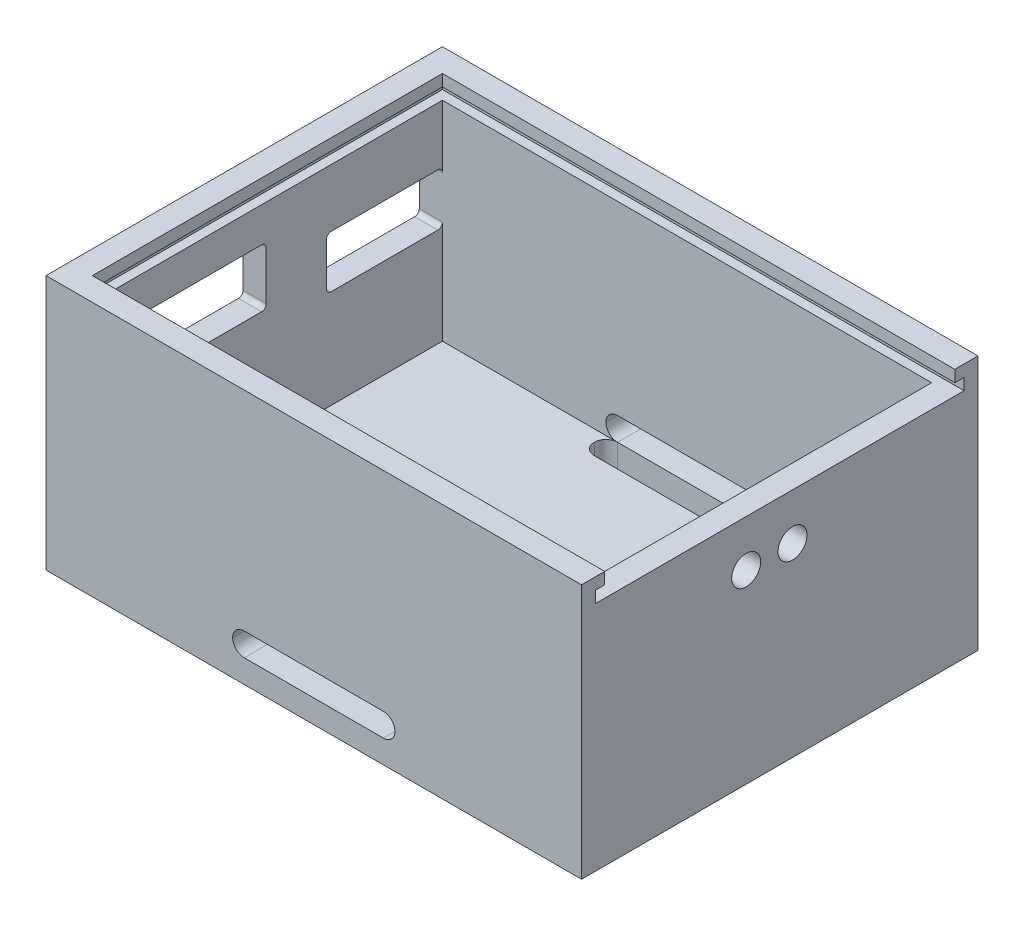
from build123d import *

# Parameters (mm, degrees)
SKETCH_1_W             = 46.2
SKETCH_1_H             = 34.2
EXTRUDE_1_DEPTH        = 22
SHELL_1_T              = -2
CUT_EXTRUDE_3_REACH    = 55.952
SKETCH_4_W             = 30.2
SKETCH_4_H             = 2
SKETCH_5_W             = 31.8
SKETCH_5_H             = 1
CUT_EXTRUDE_4_DEPTH    = 45
CUT_EXTRUDE_6_REACH    = 38.194
SKETCH_8_W             = 14
SKETCH_8_H             = 2
CUT_EXTRUDE_7_REACH    = 48.768
SKETCH_9_W             = 14
SKETCH_9_H             = 2
FILLET_3_R             = 1
FILLET_4_R             = 1
FILLET_3_OF_MIRROR_1_R = 1
FILLET_4_OF_MIRROR_1_R = 1
CUT_EXTRUDE_8_REACH    = 55.952
SKETCH_10_W            = 10
SKETCH_10_H            = 4.5
FILLET_6_R             = 0.4
CUT_EXTRUDE_9_REACH    = 55.952
SKETCH_11_W            = 11
SKETCH_11_H            = 5
FILLET_7_R             = 0.4
CUT_EXTRUDE_10_REACH   = 55.952
SKETCH_12_R            = 1.25


# Some blends are built 0.0001 mm under size
with BuildPart() as part:
    # 草图1 → 凸台-拉伸1 (new body)
    with BuildSketch(Plane(origin=(0, 0, 0), x_dir=(1, 0, 0), z_dir=(0, 1, 0))):
        Rectangle(SKETCH_1_W, SKETCH_1_H)
    extrude(amount=EXTRUDE_1_DEPTH)

    # 抽壳1
    shell_1_openings = [part.faces().sort_by_distance(p)[0] for p in [
        (0, 22, 0),
    ]]
    offset(amount=SHELL_1_T, openings=shell_1_openings, kind=Kind.INTERSECTION)

    # 草图4 → 切除-拉伸3 (cut, up to next)
    with BuildSketch(Plane(origin=(23.1, 0, 0), x_dir=(0, 0, -1), z_dir=(1, 0, 0)), mode=Mode.PRIVATE) as cut_extrude_3_sk1:
        with Locations((0, 21)):
            Rectangle(SKETCH_4_W, SKETCH_4_H)
    cut_extrude_3_tool1 = extrude(cut_extrude_3_sk1.sketch, amount=-CUT_EXTRUDE_3_REACH, mode=Mode.PRIVATE) & part.part
    add(cut_extrude_3_tool1.solids().sort_by_distance((23.1, 21, 0))[0], mode=Mode.SUBTRACT)

    # 草图5 → 切除-拉伸4 (cut)
    with BuildSketch(Plane(origin=(23.1, 0, 0), x_dir=(0, 0, -1), z_dir=(1, 0, 0))):
        with Locations((0, 20.5)):
            Rectangle(SKETCH_5_W, SKETCH_5_H)
    extrude(amount=-CUT_EXTRUDE_4_DEPTH, mode=Mode.SUBTRACT)

    # 草图8 → 切除-拉伸6 (cut, up to next)
    with BuildSketch(Plane.XZ, mode=Mode.PRIVATE) as cut_extrude_6_sk1:
        with Locations((0, -14.1)):
            Rectangle(SKETCH_8_W, SKETCH_8_H)
    cut_extrude_6_tool1 = extrude(cut_extrude_6_sk1.sketch, amount=-CUT_EXTRUDE_6_REACH, mode=Mode.PRIVATE) & part.part
    cut_extrude_6 = cut_extrude_6_tool1.solids().sort_by_distance((0, 0, -14.1))[0]
    add(cut_extrude_6, mode=Mode.SUBTRACT)

    # 草图9 → 切除-拉伸7 (cut, up to next)
    with BuildSketch(Plane(origin=(0, 0, -17.1), x_dir=(-1, 0, 0), z_dir=(0, 0, -1)), mode=Mode.PRIVATE) as cut_extrude_7_sk1:
        with Locations((0, 3)):
            Rectangle(SKETCH_9_W, SKETCH_9_H)
    cut_extrude_7_tool1 = extrude(cut_extrude_7_sk1.sketch, amount=-CUT_EXTRUDE_7_REACH, mode=Mode.PRIVATE) & part.part
    cut_extrude_7 = cut_extrude_7_tool1.solids().sort_by_distance((0, 3, -17.1))[0]
    add(cut_extrude_7, mode=Mode.SUBTRACT)

    # 圆角3
    # the kernel refuses this fillet: 1 mm, written as the material it adds along each edge
    with BuildSketch(Plane(origin=(-7, 4, -17.1), x_dir=(0, -1, 0), z_dir=(0, 0, 1)), Plane(origin=(-7, 2, -17.1), x_dir=(1, 0, 0), z_dir=(0, 0, 1)), Plane(origin=(7, 2, -17.1), x_dir=(0, 1, 0), z_dir=(0, 0, 1))) as fillet_3_piece_1:
        with BuildLine():
            CenterArc((FILLET_3_R, FILLET_3_R), FILLET_3_R, 180, 90)
            Line((0, FILLET_3_R), (0, 0))
            Line((0, 0), (FILLET_3_R, 0))
        make_face()
    extrude(amount=2)
    with BuildSketch(Plane(origin=(7, 4, -17.1), x_dir=(0, -1, 0), z_dir=(0, 0, 1))) as fillet_3_piece_2:
        with BuildLine():
            CenterArc((FILLET_3_R, -FILLET_3_R), FILLET_3_R, 90, 90)
            Line((0, -FILLET_3_R), (0, 0))
            Line((0, 0), (FILLET_3_R, 0))
        make_face()
    extrude(amount=2)

    # 圆角4
    fillet_4_edges = [part.edges().sort_by_distance(p)[0] for p in [
        (-7, 1, -15.1),
        (-7, 1, -13.1),
        (7, 1, -15.1),
        (7, 1, -13.1),
    ]]
    fillet(fillet_4_edges, radius=FILLET_4_R - 0.0001)  # a hair under: the kernel refuses the full size

    # 镜向1: 切除-拉伸6, 切除-拉伸7 across plane
    add(cut_extrude_6.mirror(Plane.XY), mode=Mode.SUBTRACT)
    add(cut_extrude_7.mirror(Plane.XY), mode=Mode.SUBTRACT)

    # 圆角3 of 镜向1
    # the kernel refuses this fillet: 1 mm, written as the material it adds along each edge
    with BuildSketch(Plane(origin=(-7, 4, 17.1), x_dir=(1, 0, 0), z_dir=(0, 0, -1)), Plane(origin=(-7, 2, 17.1), x_dir=(0, 1, 0), z_dir=(0, 0, -1)), Plane(origin=(7, 2, 17.1), x_dir=(-1, 0, 0), z_dir=(0, 0, -1))) as fillet_3_of_mirror_1_piece_1:
        with BuildLine():
            CenterArc((FILLET_3_OF_MIRROR_1_R, FILLET_3_OF_MIRROR_1_R), FILLET_3_OF_MIRROR_1_R, 180, 90)
            Line((0, FILLET_3_OF_MIRROR_1_R), (0, 0))
            Line((0, 0), (FILLET_3_OF_MIRROR_1_R, 0))
        make_face()
    extrude(amount=2)
    with BuildSketch(Plane(origin=(7, 4, 17.1), x_dir=(-1, 0, 0), z_dir=(0, 0, -1))) as fillet_3_of_mirror_1_piece_2:
        with BuildLine():
            CenterArc((FILLET_3_OF_MIRROR_1_R, -FILLET_3_OF_MIRROR_1_R), FILLET_3_OF_MIRROR_1_R, 90, 90)
            Line((0, -FILLET_3_OF_MIRROR_1_R), (0, 0))
            Line((0, 0), (FILLET_3_OF_MIRROR_1_R, 0))
        make_face()
    extrude(amount=2)

    # 圆角4 of 镜向1
    fillet_4_of_mirror_1_edges = [part.edges().sort_by_distance(p)[0] for p in [
        (-7, 1, 15.1),
        (-7, 1, 13.1),
        (7, 1, 15.1),
        (7, 1, 13.1),
    ]]
    fillet(fillet_4_of_mirror_1_edges, radius=FILLET_4_OF_MIRROR_1_R - 0.0001)  # a hair under: the kernel refuses the full size

    # 草图10 → 切除-拉伸8 (cut, up to next)
    with BuildSketch(Plane.ZY.offset(23.1), mode=Mode.PRIVATE) as cut_extrude_8_sk1:
        with Locations((-10.1, 12.75)):
            Rectangle(SKETCH_10_W, SKETCH_10_H)
    cut_extrude_8_tool1 = extrude(cut_extrude_8_sk1.sketch, amount=-CUT_EXTRUDE_8_REACH, mode=Mode.PRIVATE) & part.part
    add(cut_extrude_8_tool1.solids().sort_by_distance((-23.1, 12.75, -10.1))[0], mode=Mode.SUBTRACT)

    # 圆角6
    fillet_6_edges = [part.edges().sort_by_distance(p)[0] for p in [
        (-22.1, 10.5, -5.1),
        (-22.1, 15, -5.1),
        (-22.1, 15, -15.1),
        (-22.1, 10.5, -15.1),
    ]]
    fillet(fillet_6_edges, radius=FILLET_6_R)

    # 草图11 → 切除-拉伸9 (cut, up to next)
    with BuildSketch(Plane.ZY.offset(23.1), mode=Mode.PRIVATE) as cut_extrude_9_sk1:
        with Locations((5.6, 14.5)):
            Rectangle(SKETCH_11_W, SKETCH_11_H)
    cut_extrude_9_tool1 = extrude(cut_extrude_9_sk1.sketch, amount=-CUT_EXTRUDE_9_REACH, mode=Mode.PRIVATE) & part.part
    add(cut_extrude_9_tool1.solids().sort_by_distance((-23.1, 14.5, 5.6))[0], mode=Mode.SUBTRACT)

    # 圆角7
    fillet_7_edges = [part.edges().sort_by_distance(p)[0] for p in [
        (-22.1, 17, 0.1),
        (-22.1, 12, 0.1),
        (-22.1, 12, 11.1),
        (-22.1, 17, 11.1),
    ]]
    fillet(fillet_7_edges, radius=FILLET_7_R)

    # 草图12 → 切除-拉伸10 (cut, up to next)
    with BuildSketch(Plane(origin=(23.1, 0, 0), x_dir=(0, 0, -1), z_dir=(1, 0, 0)), mode=Mode.PRIVATE) as cut_extrude_10_sk1:
        with Locations((-2.9, 16)):
            Circle(SKETCH_12_R)
    cut_extrude_10_tool1 = extrude(cut_extrude_10_sk1.sketch, amount=-CUT_EXTRUDE_10_REACH, mode=Mode.PRIVATE) & part.part
    # 草图12 → 切除-拉伸10 (cut, up to next)
    with BuildSketch(Plane(origin=(23.1, 0, 0), x_dir=(0, 0, -1), z_dir=(1, 0, 0)), mode=Mode.PRIVATE) as cut_extrude_10_sk2:
        with Locations((1.1, 16)):
            Circle(SKETCH_12_R)
    cut_extrude_10_tool2 = extrude(cut_extrude_10_sk2.sketch, amount=-CUT_EXTRUDE_10_REACH, mode=Mode.PRIVATE) & part.part
    add(cut_extrude_10_tool1.solids().sort_by_distance((23.1, 16, 2.9))[0], mode=Mode.SUBTRACT)
    add(cut_extrude_10_tool2.solids().sort_by_distance((23.1, 16, -1.1))[0], mode=Mode.SUBTRACT)


solid = part.part
